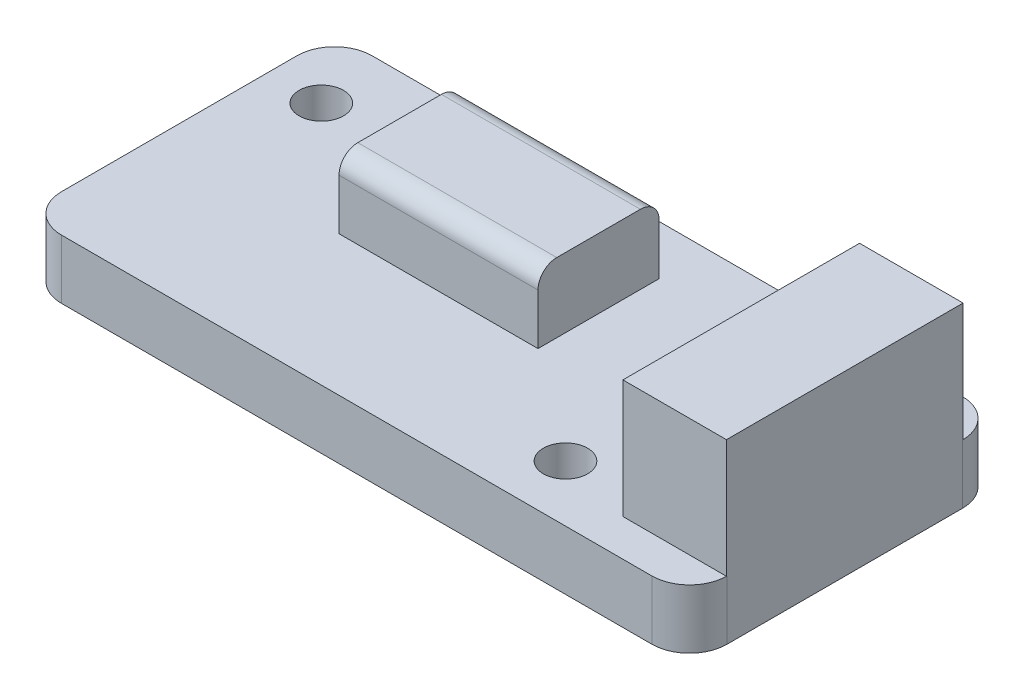
from build123d import *

# Parameters (mm, degrees)
BOSS_EXTRUDE1_DEPTH = 4
SKETCH2_W           = 7
SKETCH2_H           = 16
BOSS_EXTRUDE2_DEPTH = 8
SKETCH3_W           = 13.452288764
SKETCH3_H           = 8.193666793
BOSS_EXTRUDE3_DEPTH = 4.698
FILLET1_R           = 1.27
SKETCH4_R           = 1.5
CUT_EXTRUDE1_DEPTH  = 27.086394921


with BuildPart() as part:
    # Sketch1 → Boss-Extrude1 (new body)
    with BuildSketch(Plane(origin=(0, 0, 0), x_dir=(1, 0, 0), z_dir=(0, 1, 0))):
        with BuildLine():
            Line((-19.96, -10.5), (19.96, -10.5))
            ThreePointArc((19.96, -10.5), (21.756051224, -9.756051224), (22.5, -7.96))
            Line((22.5, -7.96), (22.5, 7.96))
            ThreePointArc((22.5, 7.96), (21.756051224, 9.756051224), (19.96, 10.5))
            Line((19.96, 10.5), (-19.96, 10.5))
            ThreePointArc((-19.96, 10.5), (-21.756051224, 9.756051224), (-22.5, 7.96))
            Line((-22.5, 7.96), (-22.5, -7.96))
            ThreePointArc((-22.5, -7.96), (-21.756051224, -9.756051224), (-19.96, -10.5))
        make_face()
    extrude(amount=BOSS_EXTRUDE1_DEPTH)

    # Sketch2 → Boss-Extrude2 (add)
    with BuildSketch(Plane(origin=(0, 4, 0), x_dir=(1, 0, 0), z_dir=(0, 1, 0))):
        with Locations((19, 0)):
            Rectangle(SKETCH2_W, SKETCH2_H)
    extrude(amount=BOSS_EXTRUDE2_DEPTH)

    # Sketch3 → Boss-Extrude3 (add)
    with BuildSketch(Plane(origin=(0, 4, 0), x_dir=(1, 0, 0), z_dir=(0, 1, 0))):
        with Locations((-3.928679787, 3.057338356)):
            Rectangle(SKETCH3_W, SKETCH3_H)
    extrude(amount=BOSS_EXTRUDE3_DEPTH)

    # Fillet1
    fillet1_edges = [part.edges().sort_by_distance(p)[0] for p in [
        (-3.928679787, 8.698, -7.154171752),
        (-3.928679787, 8.698, 1.039495041),
    ]]
    fillet(fillet1_edges, radius=FILLET1_R)

    # Sketch4 → Cut-Extrude1 (cut, through all)
    with BuildSketch(Plane(origin=(0, 4, 0), x_dir=(1, 0, 0), z_dir=(0, 1, 0))):
        with Locations((-18.902, 6.01)):
            Circle(SKETCH4_R)
        with Locations((10.308, -6.69)):
            Circle(SKETCH4_R)
    extrude(amount=-CUT_EXTRUDE1_DEPTH, mode=Mode.SUBTRACT)


solid = part.part
